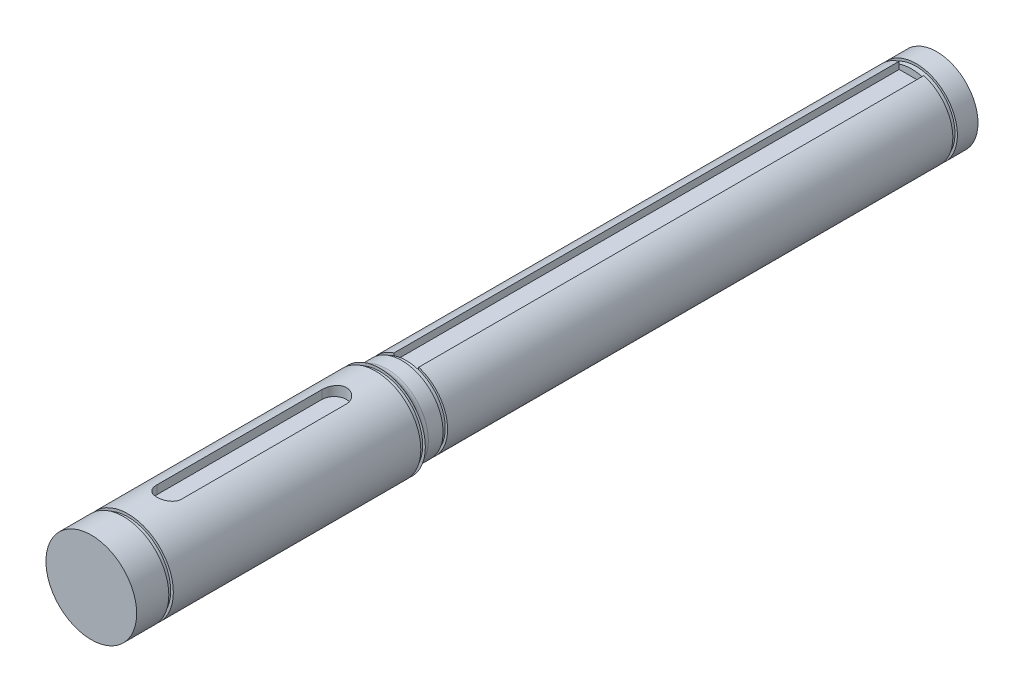
from build123d import *

# Parameters (mm, degrees)
SKETCH2_R           = 10
BOSS_EXTRUDE1_DEPTH = 135
SKETCH3_R           = 10
SKETCH3_R_2         = 9.43
CUT_EXTRUDE2_DEPTH  = 1.1
SKETCH4_W           = 6
SKETCH4_H           = 3.067792635
CUT_EXTRUDE3_DEPTH  = 61.25
SKETCH5_R           = 11
BOSS_EXTRUDE2_DEPTH = 70
FILLET3_R           = 2
SKETCH6_R           = 11
SKETCH6_R_2         = 10.35
CUT_EXTRUDE4_DEPTH  = 1.1
CUT_EXTRUDE5_DEPTH  = 2.5


with BuildPart() as part:
    # Sketch2 → Boss-Extrude1 (new body)
    with BuildSketch(Plane.XY):
        Circle(SKETCH2_R)
    extrude(amount=BOSS_EXTRUDE1_DEPTH)

    # Sketch3 → Cut-Extrude2 (cut)
    with BuildSketch(Plane(origin=(0, 0, 5), x_dir=(-1, 0, 0), z_dir=(0, 0, -1))):
        Circle(SKETCH3_R)
        Circle(SKETCH3_R_2, mode=Mode.SUBTRACT)
    cut_extrude2 = extrude(amount=-CUT_EXTRUDE2_DEPTH, mode=Mode.SUBTRACT)

    # Mirror1: Cut-Extrude2 across plane
    add(cut_extrude2.mirror(Plane(origin=(0, 0, 67.35), x_dir=(1, 0, 0), z_dir=(0, 0, -1))), mode=Mode.SUBTRACT)

    # Sketch4 → Cut-Extrude3 (cut, symmetric)
    with BuildSketch(Plane(origin=(0, 0, 67.35), x_dir=(-1, 0, 0), z_dir=(0, 0, -1))):
        with Locations((0, 9.343896318)):
            Rectangle(SKETCH4_W, SKETCH4_H)
    extrude(amount=CUT_EXTRUDE3_DEPTH, both=True, mode=Mode.SUBTRACT)

    # Sketch5 → Boss-Extrude2 (add)
    with BuildSketch(Plane.XY.offset(135)):
        Circle(SKETCH5_R)
    extrude(amount=BOSS_EXTRUDE2_DEPTH)

    # Fillet3
    # the kernel refuses this fillet: 2 mm, written as the material it adds along each edge
    with BuildSketch(Plane(origin=(0, 0, 135), x_dir=(1, 0, 0), z_dir=(0, -1, 0))) as fillet3_piece_1:
        with BuildLine():
            CenterArc((12, -1.732050808), FILLET3_R, 120, 60)
            Line((10, -1.732050808), (9.96, -1.732050808))
            Line((9.96, -1.732050808), (9.96, 0))
            Line((9.96, 0), (10, 0.04))
            ThreePointArc((10, 0.04), (10.5, 0.04), (10.98, 0.034641016))
            Line((10.98, 0.034641016), (11, 0))
        make_face()
    revolve(axis=Axis((0, 0, 135), (0, 0, 1)))

    # Sketch6 → Cut-Extrude4 (cut)
    with BuildSketch(Plane.XY.offset(135)):
        Circle(SKETCH6_R)
        Circle(SKETCH6_R_2, mode=Mode.SUBTRACT)
    cut_extrude4 = extrude(amount=CUT_EXTRUDE4_DEPTH, mode=Mode.SUBTRACT)

    # Mirror2: Cut-Extrude4 across plane
    add(cut_extrude4.mirror(Plane.XY.offset(166.1)), mode=Mode.SUBTRACT)

    # Sketch8 → Cut-Extrude5 (cut)
    with BuildSketch(Plane(origin=(0, 11, 0), x_dir=(1, 0, 0), z_dir=(0, 1, 0))):
        with BuildLine():
            Line((3, -146.1), (3, -186.1))
            ThreePointArc((3, -186.1), (0, -189.1), (-3, -186.1))
            Line((-3, -186.1), (-3, -146.1))
            ThreePointArc((-3, -146.1), (0, -143.1), (3, -146.1))
        make_face()
    extrude(amount=-CUT_EXTRUDE5_DEPTH, mode=Mode.SUBTRACT)


solid = part.part
